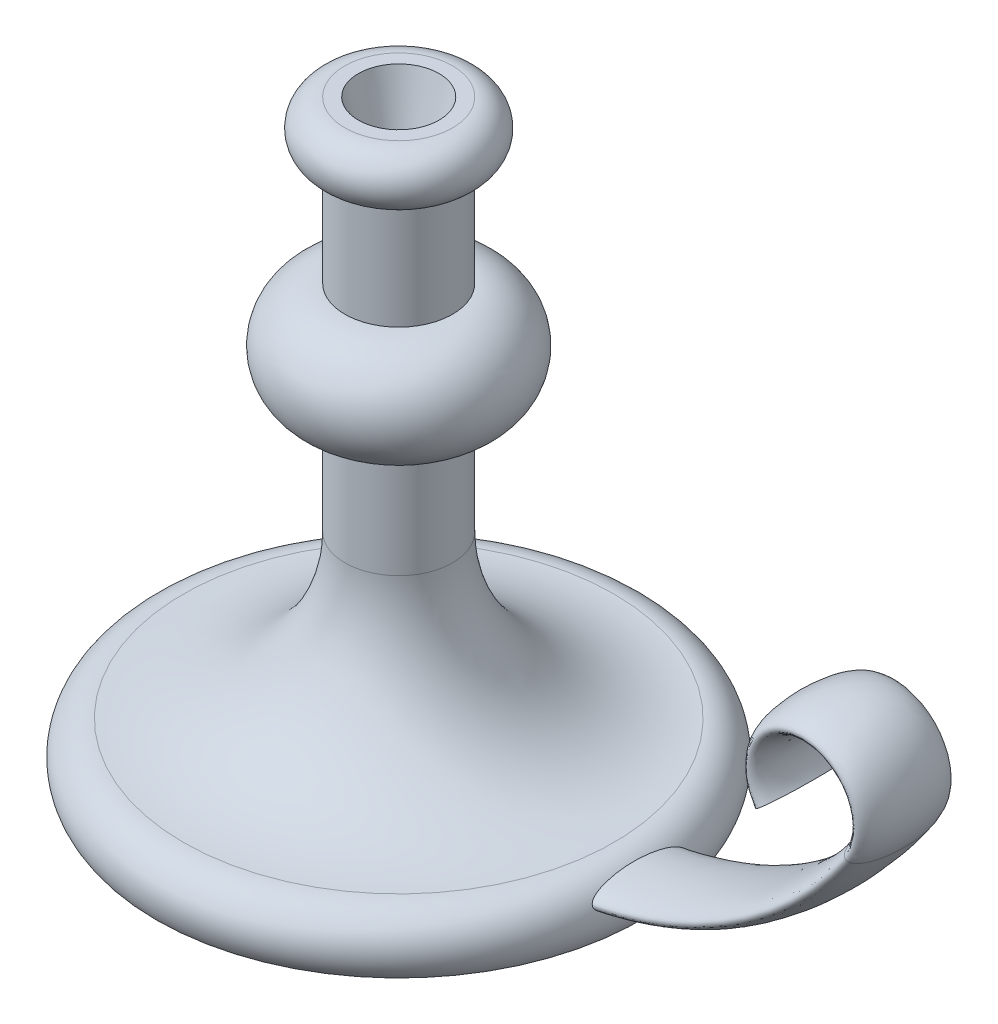
from build123d import *

# Parameters (mm, degrees)
SKETCH5_RX         = 17.5
SKETCH5_RY         = 5
SKETCH6_R          = 15
CUT_EXTRUDE1_DEPTH = 25
CUT_EXTRUDE1_DRAFT = -15


with BuildPart() as part:
    # Sketch2 → Revolve1 (revolve)
    with BuildSketch(Plane.XY):
        with BuildLine():
            Line((0, 0), (0, 220))
            Line((0, 220), (20, 220))
            ThreePointArc((20, 220), (30, 210), (20, 200))
            Line((20, 200), (20, 160))
            ThreePointArc((20, 160), (40, 140), (20, 120))
            Line((20, 120), (20, 80))
            ThreePointArc((20, 80), (37.573593129, 37.573593129), (80, 20))
            ThreePointArc((80, 20), (91.180339887, 13.090169944), (90, 0))
            Line((90, 0), (0, 0))
        make_face()
    revolve(axis=Axis((0, 0, 0), (0, 1, 0)))

    # Sweep1: sweep along a path in Sketch4
    with BuildLine(Plane.XY) as sweep1_path:
        Line((0, 10), (60, 10))
        ThreePointArc((60, 10), (129.821200219, 27.240819526), (183.592070943, 75))
        ThreePointArc((183.592070943, 75), (167.113128151, 106.333333333), (150.634185358, 75))
    # Sketch5 → Sweep1 (sweep)
    with BuildSketch(Plane(origin=(0, 0, 0), x_dir=(0, 0, -1), z_dir=(1, 0, 0))):
        with Locations(Location((0, 10), (0, 0, 180))):
            Ellipse(SKETCH5_RX, SKETCH5_RY)
    sweep(path=sweep1_path.line)


with BuildPart() as cut_extrude1_tool:
    # Sketch6 → Cut-Extrude1 (with draft: the straight prism first)
    with BuildSketch(Plane(origin=(0, 220, 0), x_dir=(1, 0, 0), z_dir=(0, 1, 0))):
        Circle(SKETCH6_R)
    extrude(amount=-CUT_EXTRUDE1_DEPTH)
    # Cut-Extrude1: the draft: its side faces are tilted about the plane it starts from
    cut_extrude1_sides = [cut_extrude1_tool.faces().sort_by_distance(p)[0] for p in [
        (-15, 207.5, 0),
    ]]
    draft(cut_extrude1_sides, Plane(origin=(0, 220, 0), x_dir=(1, 0, 0), z_dir=(0, 1, 0)), CUT_EXTRUDE1_DRAFT)


with BuildPart() as part_1:
    add(part.part)

    # Cut-Extrude1: cut by cut_extrude1_tool
    add(cut_extrude1_tool.part, mode=Mode.SUBTRACT)


solid = part_1.part
